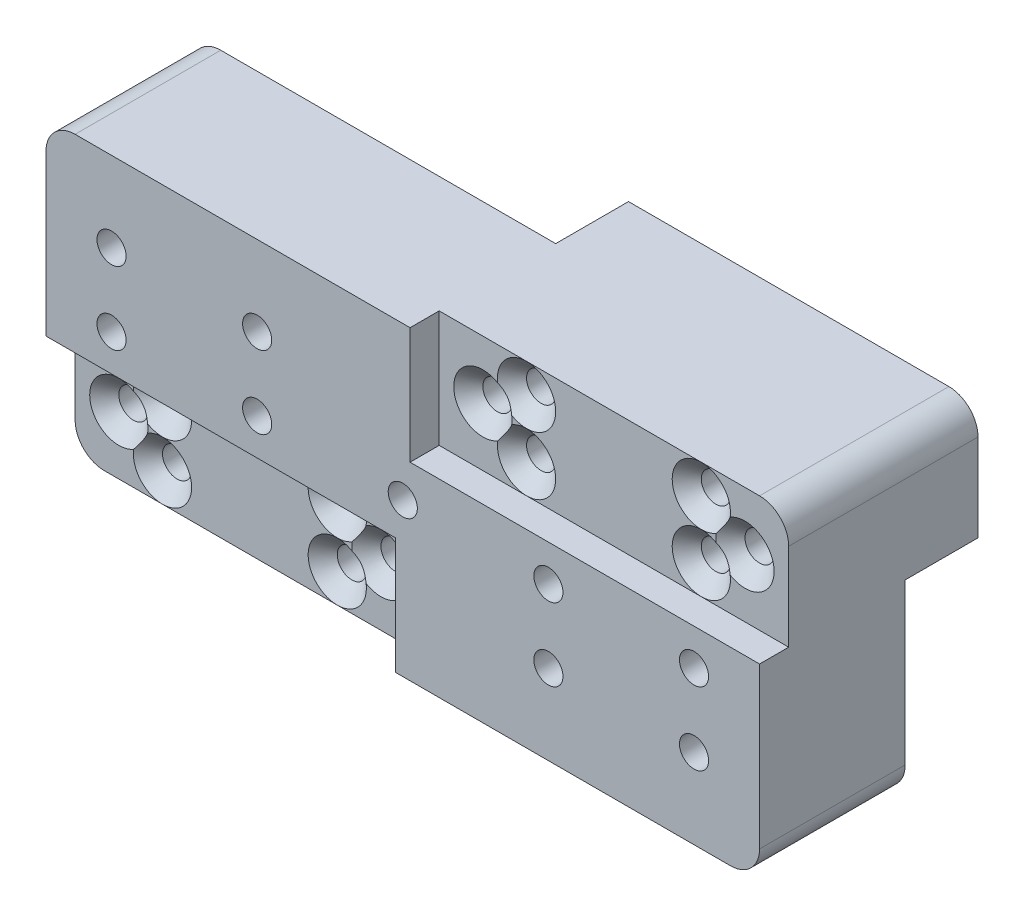
from build123d import *

# Parameters (mm, degrees)
SKETCH1_W             = 24
SKETCH1_H             = 8
SKETCH1_R             = 1
BOSS_EXTRUDE1_DEPTH   = 5
BOSS_EXTRUDE1_2_DEPTH = 5
SKETCH2_W             = 24
SKETCH2_H             = 8
SKETCH2_R             = 1
BOSS_EXTRUDE2_DEPTH   = 8
BOSS_EXTRUDE3_DEPTH   = 10
CHAMFER1_SIZE         = 1
FILLET1_R             = 2
SKETCH3_R             = 1
CUT_EXTRUDE1_DEPTH    = 7


with BuildPart() as part:
    # Sketch1 → Boss-Extrude1 (new body)
    with BuildSketch(Plane.XY):
        with Locations((-8.500045519, -6.479626746)):
            Rectangle(SKETCH1_W, SKETCH1_H)
        with Locations(Location((0.499954481, -6.479626746, 0), (0, 0, 180))):
            Circle(SKETCH1_R, mode=Mode.SUBTRACT)
        with Locations((-14.500045519, -4.479626746)):
            Circle(SKETCH1_R, mode=Mode.SUBTRACT)
        with Locations((-2.500045519, -8.479626746)):
            Circle(SKETCH1_R, mode=Mode.SUBTRACT)
        with Locations((-17.500045519, -6.479626746)):
            Circle(SKETCH1_R, mode=Mode.SUBTRACT)
        with Locations(Location((-14.500045519, -8.479626746, 0), (0, 0, 180))):
            Circle(SKETCH1_R, mode=Mode.SUBTRACT)
        with Locations(Location((-2.500045519, -4.479626746, 0), (0, 0, 180))):
            Circle(SKETCH1_R, mode=Mode.SUBTRACT)
    extrude(amount=BOSS_EXTRUDE1_DEPTH)



with BuildPart() as body_2:
    # Sketch1 → Boss-Extrude1 2 (new body)
    with BuildSketch(Plane.XY):
        with Locations((16.499954481, 6.520373254)):
            Rectangle(SKETCH1_W, SKETCH1_H)
        with Locations((10.499954481, 8.520373254)):
            Circle(SKETCH1_R, mode=Mode.SUBTRACT)
        with Locations((7.499954481, 6.520373254)):
            Circle(SKETCH1_R, mode=Mode.SUBTRACT)
        with Locations(Location((10.499954481, 4.520373254, 0), (0, 0, 180))):
            Circle(SKETCH1_R, mode=Mode.SUBTRACT)
        with Locations((22.499954481, 4.520373254)):
            Circle(SKETCH1_R, mode=Mode.SUBTRACT)
        with Locations(Location((25.499954481, 6.520373254, 0), (0, 0, 180))):
            Circle(SKETCH1_R, mode=Mode.SUBTRACT)
        with Locations(Location((22.499954481, 8.520373254, 0), (0, 0, 180))):
            Circle(SKETCH1_R, mode=Mode.SUBTRACT)
    extrude(amount=BOSS_EXTRUDE1_2_DEPTH)


with BuildPart() as part_1:
    add(part.part)

    add(body_2.part)  # Boss-Extrude2 merges body 2
    # Sketch2 → Boss-Extrude2 (add)
    # profile 1 of 3: a face of its own
    with BuildSketch(Plane.XY.offset(5)):
        with Locations((-8.500045519, -6.479626746)):
            Rectangle(SKETCH2_W, SKETCH2_H)
        with Locations(Location((-14.500045519, -8.479626746, 0), (0, 0, 180))):
            Circle(SKETCH2_R, mode=Mode.SUBTRACT)
        with Locations((-17.500045519, -6.479626746)):
            Circle(SKETCH2_R, mode=Mode.SUBTRACT)
        with Locations((-2.500045519, -8.479626746)):
            Circle(SKETCH2_R, mode=Mode.SUBTRACT)
        with Locations(Location((0.499954481, -6.479626746, 0), (0, 0, 180))):
            Circle(SKETCH2_R, mode=Mode.SUBTRACT)
        with Locations((-14.500045519, -4.479626746)):
            Circle(SKETCH2_R, mode=Mode.SUBTRACT)
        with Locations(Location((-2.500045519, -4.479626746, 0), (0, 0, 180))):
            Circle(SKETCH2_R, mode=Mode.SUBTRACT)
    # profile 2 of 3: a face of its own
    with BuildSketch(Plane.XY.offset(5)):
        Polygon((3.499954481, -2.479626746), (3.499954481, -10.479626746), (28.499954481, -10.479626746), (28.499954481, 2.520373254), (4.499954481, 2.520373254), (4.499954481, 10.520373254), (-20.500045519, 10.520373254), (-20.500045519, -2.479626746), align=None)
    # profile 3 of 3: a face of its own
    with BuildSketch(Plane.XY.offset(5)):
        with Locations((16.499954481, 6.520373254)):
            Rectangle(SKETCH2_W, SKETCH2_H)
        with Locations(Location((10.499954481, 4.520373254, 0), (0, 0, 180))):
            Circle(SKETCH2_R, mode=Mode.SUBTRACT)
        with Locations((22.499954481, 4.520373254)):
            Circle(SKETCH2_R, mode=Mode.SUBTRACT)
        with Locations((7.499954481, 6.520373254)):
            Circle(SKETCH2_R, mode=Mode.SUBTRACT)
        with Locations((10.499954481, 8.520373254)):
            Circle(SKETCH2_R, mode=Mode.SUBTRACT)
        with Locations(Location((25.499954481, 6.520373254, 0), (0, 0, 180))):
            Circle(SKETCH2_R, mode=Mode.SUBTRACT)
        with Locations(Location((22.499954481, 8.520373254, 0), (0, 0, 180))):
            Circle(SKETCH2_R, mode=Mode.SUBTRACT)
    extrude(amount=BOSS_EXTRUDE2_DEPTH)

    # Sketch2<6> → Boss-Extrude3 (add)
    with BuildSketch(Plane.XY.offset(5)):
        Polygon((3.499954481, -2.479626746), (3.499954481, -10.479626746), (28.499954481, -10.479626746), (28.499954481, 2.520373254), (4.499954481, 2.520373254), (4.499954481, 10.520373254), (-20.500045519, 10.520373254), (-20.500045519, -2.479626746), align=None)
    extrude(amount=BOSS_EXTRUDE3_DEPTH)

    # Chamfer1
    # the kernel refuses this chamfer: 1 mm, written as the material it takes off along each edge
    with BuildSketch(Plane(origin=(25.499954481, 6.520373254, 13), x_dir=(-1, 0, 0), z_dir=(0, 1, 0))) as chamfer1_piece_1:
        Polygon((1 + CHAMFER1_SIZE, 0), (1, -CHAMFER1_SIZE), (1, 0), align=None)
    revolve(axis=Axis((25.499954481, 6.520373254, 13), (0, 0, 1)), mode=Mode.SUBTRACT)
    with BuildSketch(Plane(origin=(22.499954481, 8.520373254, 13), x_dir=(-1, 0, 0), z_dir=(0, 1, 0))) as chamfer1_piece_2:
        Polygon((1 + CHAMFER1_SIZE, 0), (1, -CHAMFER1_SIZE), (1, 0), align=None)
    revolve(axis=Axis((22.499954481, 8.520373254, 13), (0, 0, 1)), mode=Mode.SUBTRACT)
    with BuildSketch(Plane(origin=(10.499954481, 4.520373254, 13), x_dir=(-1, 0, 0), z_dir=(0, 1, 0))) as chamfer1_piece_3_section:
        Polygon((1 + CHAMFER1_SIZE, 0), (1, -CHAMFER1_SIZE), (1, 0), align=None)
    chamfer1_piece_3 = revolve(axis=Axis((10.499954481, 4.520373254, 13), (0, 0, 1)), mode=Mode.PRIVATE)
    chamfer1_piece_3 = split(chamfer1_piece_3, bisect_by=Plane(origin=(11.988197193, 2.520373254, 12.511757288), z_dir=(0, 1, 0)), keep=Keep.TOP, mode=Mode.PRIVATE)
    add(chamfer1_piece_3, mode=Mode.SUBTRACT)
    with BuildSketch(Plane(origin=(10.499954481, 8.520373254, 13), x_dir=(1, 0, 0), z_dir=(0, -1, 0))) as chamfer1_piece_4:
        Polygon((1 + CHAMFER1_SIZE, 0), (1, -CHAMFER1_SIZE), (1, 0), align=None)
    revolve(axis=Axis((10.499954481, 8.520373254, 13), (0, 0, 1)), mode=Mode.SUBTRACT)
    with BuildSketch(Plane(origin=(7.499954481, 6.520373254, 13), x_dir=(1, 0, 0), z_dir=(0, -1, 0))) as chamfer1_piece_5:
        Polygon((1 + CHAMFER1_SIZE, 0), (1, -CHAMFER1_SIZE), (1, 0), align=None)
    revolve(axis=Axis((7.499954481, 6.520373254, 13), (0, 0, 1)), mode=Mode.SUBTRACT)
    with BuildSketch(Plane(origin=(22.499954481, 4.520373254, 13), x_dir=(1, 0, 0), z_dir=(0, -1, 0))) as chamfer1_piece_6_section:
        Polygon((1 + CHAMFER1_SIZE, 0), (1, -CHAMFER1_SIZE), (1, 0), align=None)
    chamfer1_piece_6 = revolve(axis=Axis((22.499954481, 4.520373254, 13), (0, 0, 1)), mode=Mode.PRIVATE)
    chamfer1_piece_6 = split(chamfer1_piece_6, bisect_by=Plane(origin=(21.011711773, 2.520373254, 12.511757292), z_dir=(0, 1, 0)), keep=Keep.TOP, mode=Mode.PRIVATE)
    add(chamfer1_piece_6, mode=Mode.SUBTRACT)
    with BuildSketch(Plane(origin=(-14.500045519, -8.479626746, 13), x_dir=(-1, 0, 0), z_dir=(0, 1, 0))) as chamfer1_piece_7:
        Polygon((1 + CHAMFER1_SIZE, 0), (1, -CHAMFER1_SIZE), (1, 0), align=None)
    revolve(axis=Axis((-14.500045519, -8.479626746, 13), (0, 0, 1)), mode=Mode.SUBTRACT)
    with BuildSketch(Plane(origin=(-2.500045519, -8.479626746, 13), x_dir=(1, 0, 0), z_dir=(0, -1, 0))) as chamfer1_piece_8:
        Polygon((1 + CHAMFER1_SIZE, 0), (1, -CHAMFER1_SIZE), (1, 0), align=None)
    revolve(axis=Axis((-2.500045519, -8.479626746, 13), (0, 0, 1)), mode=Mode.SUBTRACT)
    with BuildSketch(Plane(origin=(-2.500045519, -4.479626746, 13), x_dir=(-1, 0, 0), z_dir=(0, 1, 0))) as chamfer1_piece_9_section:
        Polygon((1 + CHAMFER1_SIZE, 0), (1, -CHAMFER1_SIZE), (1, 0), align=None)
    chamfer1_piece_9 = revolve(axis=Axis((-2.500045519, -4.479626746, 13), (0, 0, 1)), mode=Mode.PRIVATE)
    chamfer1_piece_9 = split(chamfer1_piece_9, bisect_by=Plane(origin=(-1.011802811, -2.479626746, 12.511757292), z_dir=(0, -1, 0)), keep=Keep.TOP, mode=Mode.PRIVATE)
    add(chamfer1_piece_9, mode=Mode.SUBTRACT)
    with BuildSketch(Plane(origin=(-17.500045519, -6.479626746, 13), x_dir=(1, 0, 0), z_dir=(0, -1, 0))) as chamfer1_piece_10:
        Polygon((1 + CHAMFER1_SIZE, 0), (1, -CHAMFER1_SIZE), (1, 0), align=None)
    revolve(axis=Axis((-17.500045519, -6.479626746, 13), (0, 0, 1)), mode=Mode.SUBTRACT)
    with BuildSketch(Plane(origin=(-14.500045519, -4.479626746, 13), x_dir=(1, 0, 0), z_dir=(0, -1, 0))) as chamfer1_piece_11_section:
        Polygon((1 + CHAMFER1_SIZE, 0), (1, -CHAMFER1_SIZE), (1, 0), align=None)
    chamfer1_piece_11 = revolve(axis=Axis((-14.500045519, -4.479626746, 13), (0, 0, 1)), mode=Mode.PRIVATE)
    chamfer1_piece_11 = split(chamfer1_piece_11, bisect_by=Plane(origin=(-15.988288231, -2.479626746, 12.511757288), z_dir=(0, -1, 0)), keep=Keep.TOP, mode=Mode.PRIVATE)
    add(chamfer1_piece_11, mode=Mode.SUBTRACT)
    with BuildSketch(Plane(origin=(0.499954481, -6.479626746, 13), x_dir=(-1, 0, 0), z_dir=(0, 1, 0))) as chamfer1_piece_12:
        Polygon((1 + CHAMFER1_SIZE, 0), (1, -CHAMFER1_SIZE), (1, 0), align=None)
    revolve(axis=Axis((0.499954481, -6.479626746, 13), (0, 0, 1)), mode=Mode.SUBTRACT)

    # Fillet1
    fillet1_edges = [part_1.edges().sort_by_distance(p)[0] for p in [
        (28.499954481, -10.479626746, 10),
        (28.499954481, 10.520373254, 6.5),
        (-20.500045519, 10.520373254, 10),
        (-20.500045519, -10.479626746, 6.5),
    ]]
    fillet(fillet1_edges, radius=FILLET1_R)

    # Sketch3 → Cut-Extrude1 (cut)
    with BuildSketch(Plane.XY.offset(15)):
        with Locations((-16.000045519, 0.020373254)):
            Circle(SKETCH3_R)
        with Locations((-16.000045519, 5.020373254)):
            Circle(SKETCH3_R)
        with Locations((-6.000045519, 5.020373254)):
            Circle(SKETCH3_R)
        with Locations((-6.000045519, 0.020373254)):
            Circle(SKETCH3_R)
        with Locations((3.999954481, 0.020373254)):
            Circle(SKETCH3_R)
        with Locations((13.999954481, 0.020373254)):
            Circle(SKETCH3_R)
        with Locations((13.999954481, -4.979626746)):
            Circle(SKETCH3_R)
        with Locations((23.999954481, 0.020373254)):
            Circle(SKETCH3_R)
        with Locations((23.999954481, -4.979626746)):
            Circle(SKETCH3_R)
    extrude(amount=-CUT_EXTRUDE1_DEPTH, mode=Mode.SUBTRACT)


solid = part_1.part
